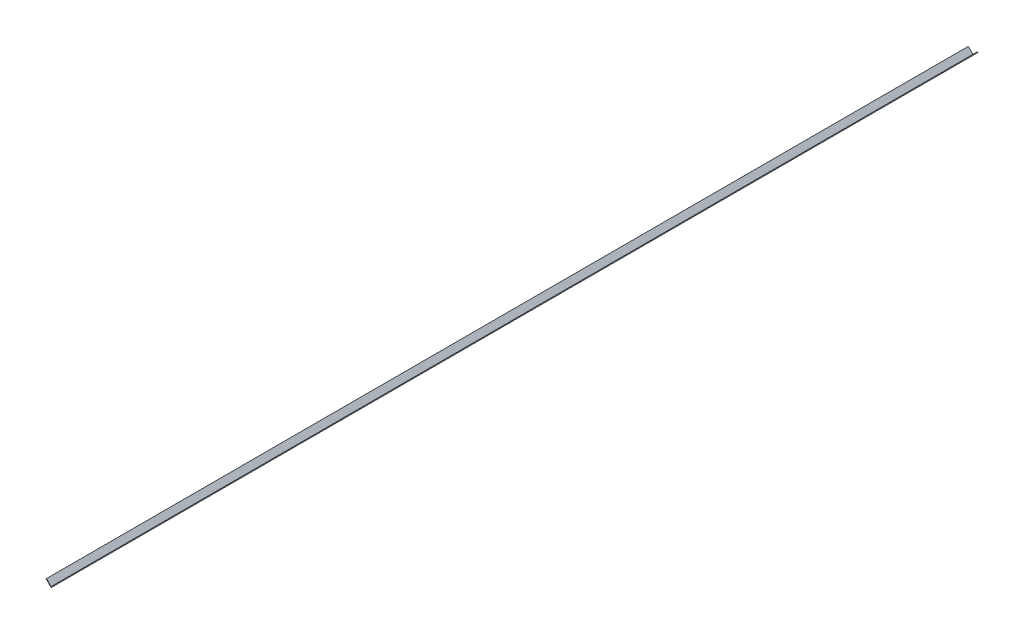
from build123d import *

# Parameters (mm, degrees)
BOSS_EXTRUDE1_DEPTH      = 1714.5
BOSS_EXTRUDE1_DEPTH_BACK = 76.2


with BuildPart() as part:
    # Sketch1 → Boss-Extrude1 (new, two sides: drawn at the far end of the back side and taken through both)
    with BuildSketch(Plane.XY.offset(-BOSS_EXTRUDE1_DEPTH_BACK)):
        Polygon((0, 0), (-8.980256121, 8.980256121), (-9.878281733, 8.082230509), (0, -1.796051224), (9.878281733, 8.082230509), (8.980256121, 8.980256121), align=None)
    extrude(amount=BOSS_EXTRUDE1_DEPTH + BOSS_EXTRUDE1_DEPTH_BACK)


solid = part.part
